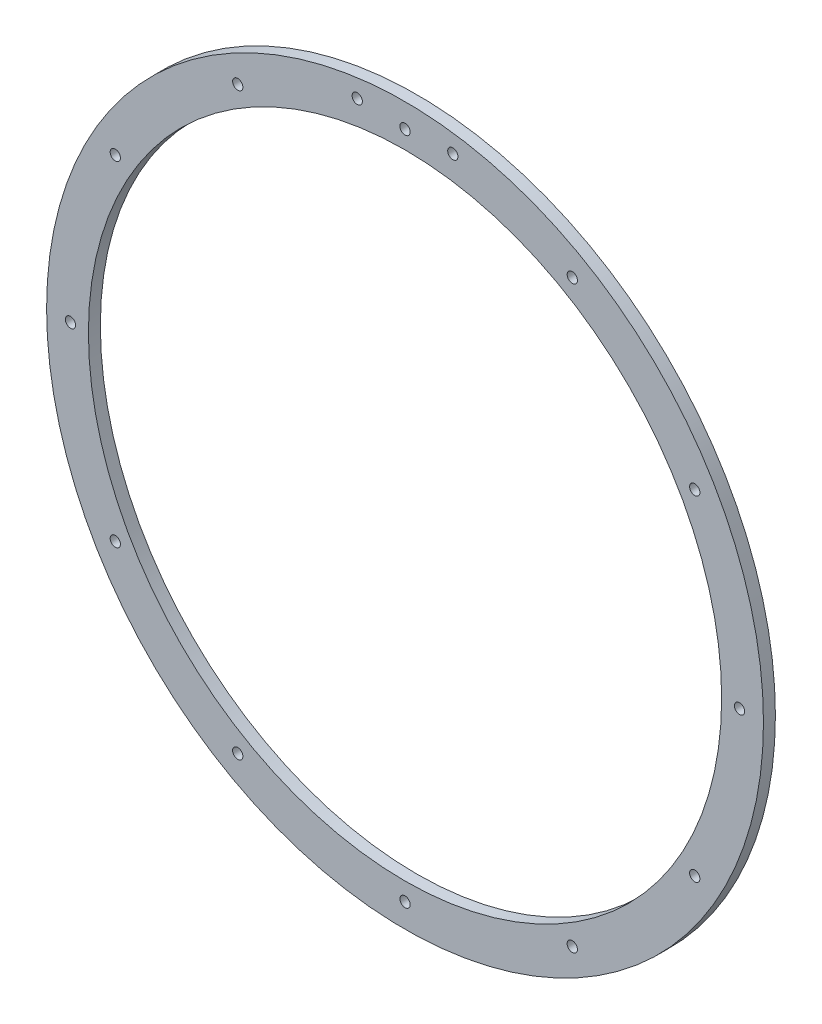
from build123d import *

# Parameters (mm, degrees)
EXTRUDE_2_DEPTH     = 5
CUT_EXTRUDE_START   = -10
SKETCH_2_R          = 183.305178761
SKETCH_2_R_2        = 150
CUT_EXTRUDE_1_DEPTH = 10
SKETCH_3_R          = 2.15
CUT_EXTRUDE_2_DEPTH = 10
SKETCH_4_R          = 2.15
CUT_EXTRUDE_3_DEPTH = 10


with BuildPart() as part:
    # 草图1 → 凸台-拉伸2 (new body)
    with BuildSketch(Plane.XY):
        with BuildLine():
            Line((-170, 50), (-170, -50))
            ThreePointArc((-170, -50), (-167.071067812, -57.071067812), (-160, -60))
            Line((-160, -60), (-143.874945699, -60))
            ThreePointArc((-143.874945699, -60), (-138.57164484, -61.522087521), (-134.882761593, -65.625))
            ThreePointArc((-134.882761593, -65.625), (-79.549512883, -127.168687184), (0, -150))
            ThreePointArc((0, -150), (79.549512883, -127.168687184), (134.882761593, -65.625))
            ThreePointArc((134.882761593, -65.625), (138.57164484, -61.522087521), (143.874945699, -60))
            Line((143.874945699, -60), (160, -60))
            ThreePointArc((160, -60), (167.071067812, -57.071067812), (170, -50))
            Line((170, -50), (170, 50))
            ThreePointArc((170, 50), (167.071067812, 57.071067812), (160, 60))
            Line((160, 60), (143.874945699, 60))
            ThreePointArc((143.874945699, 60), (138.57164484, 61.522087521), (134.882761593, 65.625))
            ThreePointArc((134.882761593, 65.625), (0, 150), (-134.882761593, 65.625))
            ThreePointArc((-134.882761593, 65.625), (-138.57164484, 61.522087521), (-143.874945699, 60))
            Line((-143.874945699, 60), (-160, 60))
            ThreePointArc((-160, 60), (-167.071067812, 57.071067812), (-170, 50))
        make_face()
        with BuildLine():
            ThreePointArc((0, -132.5), (132.5, 0), (0, 132.5))
            ThreePointArc((0, 132.5), (-132.5, 0), (0, -132.5))
        make_face(mode=Mode.SUBTRACT)
    extrude(amount=EXTRUDE_2_DEPTH)

    # 草图2 → 切除-拉伸1 (cut)
    with BuildSketch(Plane.XY.offset(5).offset(CUT_EXTRUDE_START)):
        Circle(SKETCH_2_R)
        Circle(SKETCH_2_R_2, mode=Mode.SUBTRACT)
    extrude(amount=CUT_EXTRUDE_1_DEPTH, mode=Mode.SUBTRACT)

    # 草图3 → 切除-拉伸2 (cut)
    with BuildSketch(Plane.XY.offset(5)):
        with Locations((0, 140)):
            Circle(SKETCH_3_R)
        with Locations((70, 121.24355653)):
            Circle(SKETCH_3_R)
        with Locations((121.24355653, 70)):
            Circle(SKETCH_3_R)
        with Locations((140, 0)):
            Circle(SKETCH_3_R)
        with Locations((121.24355653, -70)):
            Circle(SKETCH_3_R)
        with Locations((70, -121.24355653)):
            Circle(SKETCH_3_R)
        with Locations((0, -140)):
            Circle(SKETCH_3_R)
        with Locations((-70, -121.24355653)):
            Circle(SKETCH_3_R)
        with Locations((-121.24355653, -70)):
            Circle(SKETCH_3_R)
        with Locations((-140, 0)):
            Circle(SKETCH_3_R)
        with Locations((-121.24355653, 70)):
            Circle(SKETCH_3_R)
        with Locations((-70, 121.24355653)):
            Circle(SKETCH_3_R)
    extrude(amount=-CUT_EXTRUDE_2_DEPTH, mode=Mode.SUBTRACT)

    # 草图4 → 切除-拉伸3 (cut)
    with BuildSketch(Plane.XY.offset(5)):
        with Locations((-20, 141.089510595)):
            Circle(SKETCH_4_R)
        with Locations((20, 141.089510595)):
            Circle(SKETCH_4_R)
    extrude(amount=-CUT_EXTRUDE_3_DEPTH, mode=Mode.SUBTRACT)


solid = part.part
